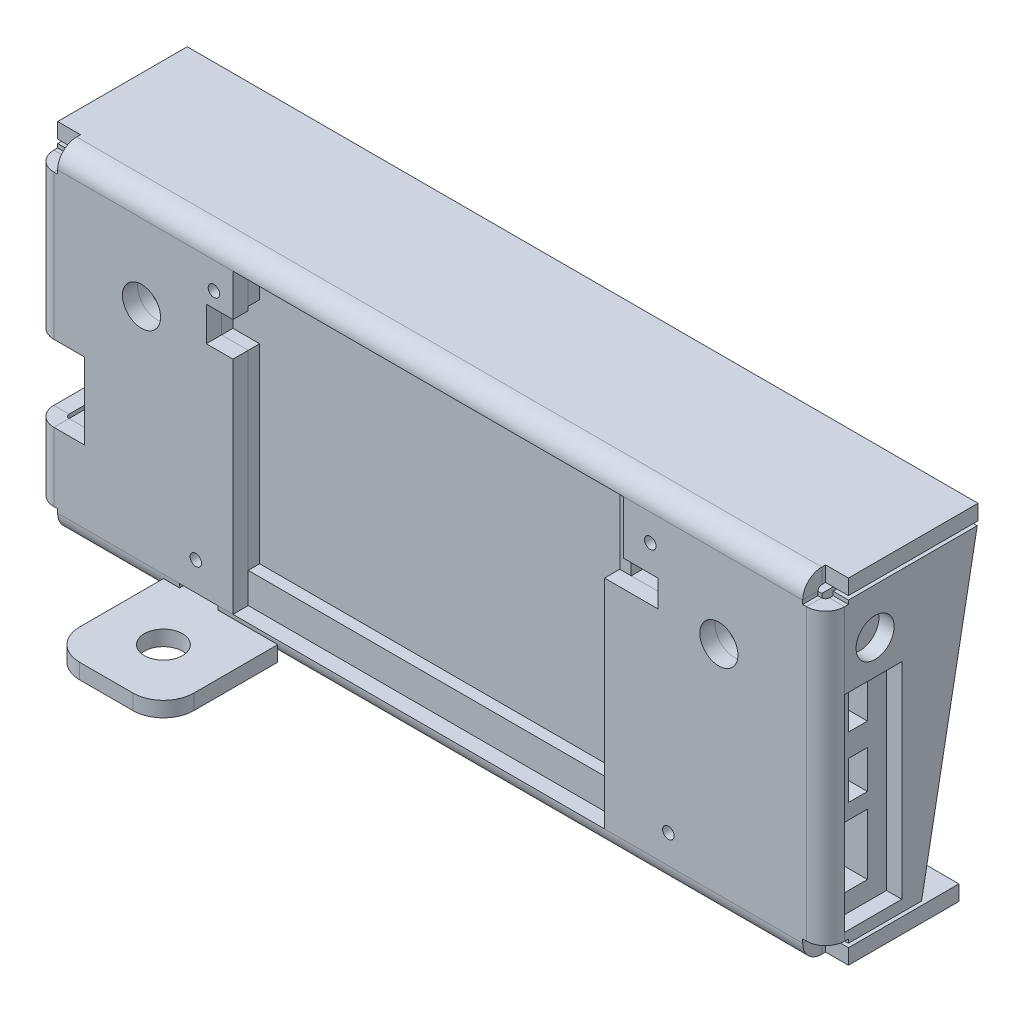
from build123d import *

# Parameters (mm, degrees)
SKETCH1_R               = 1.2
SKETCH1_R_2             = 5
SKETCH1_W               = 13
SKETCH1_H               = 11
SKETCH1_W_2             = 10
SKETCH1_H_2             = 16
BOSS_EXTRUDE2_DEPTH     = 3
SKETCH2_W               = 197.5
SKETCH2_H               = 78
BOSS_EXTRUDE3_DEPTH     = 18
SKETCH3_W               = 191.5
SKETCH3_H               = 72
CUT_EXTRUDE1_DEPTH      = 1
SKETCH4_W               = 177.5
SKETCH4_H               = 55
CUT_EXTRUDE2_DEPTH      = 1
SKETCH5_W               = 11
SKETCH5_H               = 20
CUT_EXTRUDE3_DEPTH      = 8
SKETCH6_R               = 1
SKETCH6_W               = 7
SKETCH6_H               = 16
SKETCH6_W_2             = 5
SKETCH6_H_2             = 10
CUT_EXTRUDE4_DEPTH      = 10
SKETCH7_R               = 1.5
SKETCH7_R_2             = 5
BOSS_EXTRUDE4_DEPTH     = 4
SKETCH10_R              = 5
BOSS_EXTRUDE6_DEPTH     = 4
SKETCH11_W              = 207.5
SKETCH11_H              = 40
BOSS_EXTRUDE7_DEPTH     = 4
SKETCH22_R              = 5
SKETCH22_W              = 15
SKETCH22_H              = 54
BOSS_EXTRUDE9_DEPTH     = 4
BOSS_EXTRUDE10_DEPTH    = 4
SKETCH30_W              = 10
SKETCH30_H              = 10
CUT_EXTRUDE5_DEPTH      = 5
CONVERT_SOLID4_START    = -5
CONVERT_SOLID4_DEPTH    = 207.5
CONVERT_SOLID4_2_DEPTH  = 207.5
CONVERT_SOLID4_3_DEPTH  = 6
CONVERT_SOLID4_START_2  = 196.5
CONVERT_SOLID4_4_DEPTH  = 6
CONVERT_SOLID4_START_3  = 43
CONVERT_SOLID4_5_DEPTH  = 153.5
CONVERT_SOLID4_START_4  = 1
CONVERT_SOLID4_6_DEPTH  = 32
CONVERT_SOLID4_START_5  = 33
CONVERT_SOLID4_7_DEPTH  = 10
CONVERT_SOLID4_8_DEPTH  = 76
CONVERT_SOLID4_9_DEPTH  = 76
CONVERT_SOLID4_START_6  = 39
CONVERT_SOLID4_10_DEPTH = 38
CONVERT_SOLID4_11_DEPTH = 18
SKETCH31_R              = 5
BOSS_EXTRUDE12_DEPTH    = 4


with BuildPart() as part:
    # Sketch1 → Boss-Extrude2 (new body)
    with BuildSketch(Plane.XY):
        Polygon((0, 0), (197.5, 0), (197.5, 78), (0, 78), (0, 39), (8, 39), (8, 19), (0, 19), align=None)
        with Locations((37.25, 7.5)):
            Circle(SKETCH1_R, mode=Mode.SUBTRACT)
        with Locations((161.25, 7.5)):
            Circle(SKETCH1_R, mode=Mode.SUBTRACT)
        with Locations((156.5, 71)):
            Circle(SKETCH1_R, mode=Mode.SUBTRACT)
        with Locations((42, 71)):
            Circle(SKETCH1_R, mode=Mode.SUBTRACT)
        with Locations((23, 58)):
            Circle(SKETCH1_R_2, mode=Mode.SUBTRACT)
        with Locations((174.5, 57)):
            Circle(SKETCH1_R_2, mode=Mode.SUBTRACT)
        Polygon((47, 75), (47, 68), (40, 68), (40, 58), (47, 58), (47, 8), (144.5, 8), (144.5, 75), align=None, mode=Mode.SUBTRACT)
        with Locations((154, 62.5)):
            Rectangle(SKETCH1_W, SKETCH1_H, mode=Mode.SUBTRACT)
        with Locations((169.5, 14)):
            Rectangle(SKETCH1_W_2, SKETCH1_H_2, mode=Mode.SUBTRACT)
        with Locations((29, 14)):
            Rectangle(SKETCH1_W_2, SKETCH1_H_2, mode=Mode.SUBTRACT)
    extrude(amount=BOSS_EXTRUDE2_DEPTH)

    # Sketch2 → Boss-Extrude3 (add)
    with BuildSketch(Plane(origin=(0, 0, 0), x_dir=(-1, 0, 0), z_dir=(0, 0, -1))):
        with Locations((-98.75, 39)):
            Rectangle(SKETCH2_W, SKETCH2_H)
    extrude(amount=BOSS_EXTRUDE3_DEPTH)

    # Sketch3 → Cut-Extrude1 (cut)
    with BuildSketch(Plane(origin=(0, 0, -18), x_dir=(-1, 0, 0), z_dir=(0, 0, -1))):
        with Locations((-98.75, 39)):
            Rectangle(SKETCH3_W, SKETCH3_H)
    extrude(amount=-CUT_EXTRUDE1_DEPTH, mode=Mode.SUBTRACT)

    # Sketch4 → Cut-Extrude2 (cut)
    with BuildSketch(Plane(origin=(0, 0, -17), x_dir=(-1, 0, 0), z_dir=(0, 0, -1))):
        with Locations((-98.75, 42.5)):
            Rectangle(SKETCH4_W, SKETCH4_H)
    extrude(amount=-CUT_EXTRUDE2_DEPTH, mode=Mode.SUBTRACT)

    # Sketch5 → Cut-Extrude3 (cut)
    with BuildSketch(Plane.ZY):
        with Locations((-2.5, 29)):
            Rectangle(SKETCH5_W, SKETCH5_H)
    extrude(amount=-CUT_EXTRUDE3_DEPTH, mode=Mode.SUBTRACT)

    # Sketch6 → Cut-Extrude4 (cut)
    with BuildSketch(Plane(origin=(197.5, 0, 0), x_dir=(0, 0, -1), z_dir=(1, 0, 0))):
        with Locations((6, 66)):
            Circle(SKETCH6_R)
        with Locations((5.5, 15)):
            Rectangle(SKETCH6_W, SKETCH6_H)
        with Locations((6.5, 32)):
            Rectangle(SKETCH6_W_2, SKETCH6_H_2)
        with Locations((6.5, 48)):
            Rectangle(SKETCH6_W_2, SKETCH6_H_2)
    extrude(amount=-CUT_EXTRUDE4_DEPTH, mode=Mode.SUBTRACT)


with BuildPart() as body_2:
    # Sketch7 → Boss-Extrude4 (new body)
    with BuildSketch(Plane.XY.offset(3)):
        Polygon((-1, 79), (198.5, 79), (198.5, -1), (-1, -1), (-1, 19), (8, 19), (8, 39), (-1, 39), align=None)
        with Locations((42, 71)):
            Circle(SKETCH7_R, mode=Mode.SUBTRACT)
        with Locations((37.25, 7.5)):
            Circle(SKETCH7_R, mode=Mode.SUBTRACT)
        with Locations((156.5, 71)):
            Circle(SKETCH7_R, mode=Mode.SUBTRACT)
        with Locations((161.25, 7.5)):
            Circle(SKETCH7_R, mode=Mode.SUBTRACT)
        with Locations((174.5, 57)):
            Circle(SKETCH7_R_2, mode=Mode.SUBTRACT)
        with Locations((23, 58)):
            Circle(SKETCH7_R_2, mode=Mode.SUBTRACT)
        Polygon((40, 67), (47, 67), (47, 78), (149.5, 78), (149.5, 64), (158.5, 64), (158.5, 57), (144.5, 57), (144.5, 0), (47, 0), (47, 58), (40, 58), align=None, mode=Mode.SUBTRACT)
    extrude(amount=BOSS_EXTRUDE4_DEPTH)

    # Sketch10 → Boss-Extrude6 (add)
    with BuildSketch(Plane.XZ.offset(1)):
        with BuildLine():
            Line((121.75, -28), (198.5, -28))
            Line((198.5, -28), (198.5, 7))
            Line((198.5, 7), (-1, 7))
            Line((-1, 7), (-1, -18))
            Line((-1, -18), (29, -18))
            Line((29, -18), (59, -28))
            Line((59, -28), (75.75, -28))
            ThreePointArc((75.75, -28), (81.406854249, -30.343145751), (83.75, -36))
            Line((83.75, -36), (83.75, -40))
            ThreePointArc((83.75, -40), (86.093145751, -45.656854249), (91.75, -48))
            Line((91.75, -48), (105.75, -48))
            ThreePointArc((105.75, -48), (111.406854249, -45.656854249), (113.75, -40))
            Line((113.75, -40), (113.75, -36))
            ThreePointArc((113.75, -36), (116.093145751, -30.343145751), (121.75, -28))
        make_face()
        with Locations((98.75, -33)):
            Circle(SKETCH10_R, mode=Mode.SUBTRACT)
    extrude(amount=BOSS_EXTRUDE6_DEPTH)

    # Sketch11 → Boss-Extrude7 (add)
    with BuildSketch(Plane(origin=(0, 79, 0), x_dir=(1, 0, 0), z_dir=(0, 1, 0))):
        with Locations((98.75, 13)):
            Rectangle(SKETCH11_W, SKETCH11_H)
    extrude(amount=BOSS_EXTRUDE7_DEPTH)

    # Sketch22 → Boss-Extrude9 (add)
    with BuildSketch(Plane(origin=(198.5, 0, 0), x_dir=(0, 0, -1), z_dir=(1, 0, 0))):
        Polygon((-7, -5), (28, -5), (28, -1), (18, -1), (33, 79), (-7, 79), align=None)
        with Locations((6, 66)):
            Circle(SKETCH22_R, mode=Mode.SUBTRACT)
        with Locations((5.5, 30)):
            Rectangle(SKETCH22_W, SKETCH22_H, mode=Mode.SUBTRACT)
    extrude(amount=BOSS_EXTRUDE9_DEPTH)

    # Sketch23 → Boss-Extrude10 (add)
    with BuildSketch(Plane.ZY.offset(1)):
        Polygon((7, 19), (-8, 19), (-8, 39), (7, 39), (7, 79), (-33, 79), (-18, -1), (-18, -5), (7, -5), align=None)
    extrude(amount=BOSS_EXTRUDE10_DEPTH)

    # Sketch30 → Cut-Extrude5 (cut)
    with BuildSketch(Plane.XZ.offset(5)):
        with Locations((38, 2)):
            Rectangle(SKETCH30_W, SKETCH30_H)
    extrude(amount=-CUT_EXTRUDE5_DEPTH, mode=Mode.SUBTRACT)

    # Convert-Solid4: read off the stored shape, not the designer's step
    # Convert-Solid4 outline → Convert-Solid4 (cut)
    with BuildSketch(Plane.YZ.offset(CONVERT_SOLID4_START)):
        with BuildLine():
            ThreePointArc((78, 7), (81.535533906, 5.535533906), (83, 2))
            Line((83, 2), (83, 7))
            Line((83, 7), (78, 7))
        make_face()
    extrude(amount=CONVERT_SOLID4_DEPTH, mode=Mode.SUBTRACT)

    # Convert-Solid4 2 outline → Convert-Solid4 2 (cut)
    with BuildSketch(Plane.YZ.offset(CONVERT_SOLID4_START)):
        with BuildLine():
            Line((77, 1), (78, 1))
            Line((78, 1), (78.00501662, -32.813440616))
            Line((78.00501662, -32.813440616), (79, -33))
            Line((79, -33), (79, 2))
            ThreePointArc((79, 2), (78.707106781, 2.707106781), (78, 3))
            Line((78, 3), (77, 3))
            Line((77, 3), (77, 1))
        make_face()
        with BuildLine():
            Line((-1, -18), (-0.00501662, -18.186559384))
            Line((-0.00501662, -18.186559384), (0, 1))
            Line((0, 1), (1, 1))
            Line((1, 1), (1, 3))
            Line((1, 3), (0, 3))
            ThreePointArc((0, 3), (-0.707106781, 2.707106781), (-1, 2))
            Line((-1, 2), (-1, -18))
        make_face()
        with BuildLine():
            Line((-5, 7), (-5, 2))
            ThreePointArc((-5, 2), (-3.535533906, 5.535533906), (0, 7))
            Line((0, 7), (-5, 7))
        make_face()
    extrude(amount=CONVERT_SOLID4_2_DEPTH, mode=Mode.SUBTRACT)

    # Convert-Solid4 3 outline → Convert-Solid4 3 (cut)
    with BuildSketch(Plane.YZ.offset(CONVERT_SOLID4_START)):
        with BuildLine():
            Line((77, 7), (77, 3))
            Line((77, 3), (78, 3))
            ThreePointArc((78, 3), (78.707106781, 2.707106781), (79, 2))
            Line((79, 2), (79, 1))
            Line((79, 1), (83, 1))
            Line((83, 1), (83, 2))
            ThreePointArc((83, 2), (81.535533906, 5.535533906), (78, 7))
            Line((78, 7), (77, 7))
        make_face()
        with BuildLine():
            Line((-5, 1), (-1, 1))
            Line((-1, 1), (-1, 2))
            ThreePointArc((-1, 2), (-0.707106781, 2.707106781), (0, 3))
            Line((0, 3), (1, 3))
            Line((1, 3), (1, 7))
            Line((1, 7), (0, 7))
            ThreePointArc((0, 7), (-3.535533906, 5.535533906), (-5, 2))
            Line((-5, 2), (-5, 1))
        make_face()
    extrude(amount=CONVERT_SOLID4_3_DEPTH, mode=Mode.SUBTRACT)

    # Convert-Solid4 4 outline → Convert-Solid4 4 (cut)
    with BuildSketch(Plane.YZ.offset(CONVERT_SOLID4_START_2)):
        with BuildLine():
            Line((77, 7), (77, 3))
            Line((77, 3), (78, 3))
            ThreePointArc((78, 3), (78.707106781, 2.707106781), (79, 2))
            Line((79, 2), (79, 1))
            Line((79, 1), (83, 1))
            Line((83, 1), (83, 2))
            ThreePointArc((83, 2), (81.535533906, 5.535533906), (78, 7))
            Line((78, 7), (77, 7))
        make_face()
        with BuildLine():
            Line((-5, 1), (-1, 1))
            Line((-1, 1), (-1, 2))
            ThreePointArc((-1, 2), (-0.707106781, 2.707106781), (0, 3))
            Line((0, 3), (1, 3))
            Line((1, 3), (1, 7))
            Line((1, 7), (0, 7))
            ThreePointArc((0, 7), (-3.535533906, 5.535533906), (-5, 2))
            Line((-5, 2), (-5, 1))
        make_face()
    extrude(amount=CONVERT_SOLID4_4_DEPTH, mode=Mode.SUBTRACT)

    # Convert-Solid4 5 outline → Convert-Solid4 5 (add)
    with BuildSketch(Plane.YZ.offset(CONVERT_SOLID4_START_3)):
        with BuildLine():
            Line((79, 3), (78, 3))
            ThreePointArc((78, 3), (78.707106781, 2.707106781), (79, 2))
            Line((79, 2), (79, 3))
        make_face()
        with BuildLine():
            Line((-1, 3), (-1, 2))
            ThreePointArc((-1, 2), (-0.707106781, 2.707106781), (0, 3))
            Line((0, 3), (-1, 3))
        make_face()
    extrude(amount=CONVERT_SOLID4_5_DEPTH)

    # Convert-Solid4 6 outline → Convert-Solid4 6 (add)
    with BuildSketch(Plane.YZ.offset(CONVERT_SOLID4_START_4)):
        with BuildLine():
            Line((79, 3), (78, 3))
            ThreePointArc((78, 3), (78.707106781, 2.707106781), (79, 2))
            Line((79, 2), (79, 3))
        make_face()
        with BuildLine():
            Line((-1, 3), (-1, 2))
            ThreePointArc((-1, 2), (-0.707106781, 2.707106781), (0, 3))
            Line((0, 3), (-1, 3))
        make_face()
    extrude(amount=CONVERT_SOLID4_6_DEPTH)

    # Convert-Solid4 7 outline → Convert-Solid4 7 (add)
    with BuildSketch(Plane.YZ.offset(CONVERT_SOLID4_START_5)):
        with BuildLine():
            Line((79, 3), (78, 3))
            ThreePointArc((78, 3), (78.707106781, 2.707106781), (79, 2))
            Line((79, 2), (79, 3))
        make_face()
    extrude(amount=CONVERT_SOLID4_7_DEPTH)

    # Convert-Solid4 8 outline → Convert-Solid4 8 (cut)
    with BuildSketch(Plane(origin=(0, 0, 0), x_dir=(1, 0, 0), z_dir=(0, 1, 0)).offset(CONVERT_SOLID4_START_4)):
        with BuildLine():
            ThreePointArc((0, -7), (-3.535533906, -5.535533906), (-5, -2))
            Line((-5, -2), (-5, -7))
            Line((-5, -7), (0, -7))
        make_face()
        with BuildLine():
            Line((202.5, -7), (202.5, -2))
            ThreePointArc((202.5, -2), (201.035533906, -5.535533906), (197.5, -7))
            Line((197.5, -7), (202.5, -7))
        make_face()
    extrude(amount=CONVERT_SOLID4_8_DEPTH, mode=Mode.SUBTRACT)

    # Convert-Solid4 9 outline → Convert-Solid4 9 (add)
    with BuildSketch(Plane(origin=(0, 0, 0), x_dir=(1, 0, 0), z_dir=(0, 1, 0)).offset(CONVERT_SOLID4_START_4)):
        with BuildLine():
            Line((198.5, -3), (198.5, -2))
            ThreePointArc((198.5, -2), (198.207106781, -2.707106781), (197.5, -3))
            Line((197.5, -3), (198.5, -3))
        make_face()
    extrude(amount=CONVERT_SOLID4_9_DEPTH)

    # Convert-Solid4 10 outline → Convert-Solid4 10 (add)
    with BuildSketch(Plane(origin=(0, 0, 0), x_dir=(1, 0, 0), z_dir=(0, 1, 0)).offset(CONVERT_SOLID4_START_6)):
        with BuildLine():
            ThreePointArc((0, -3), (-0.707106781, -2.707106781), (-1, -2))
            Line((-1, -2), (-1, -3))
            Line((-1, -3), (0, -3))
        make_face()
    extrude(amount=CONVERT_SOLID4_10_DEPTH)

    # Convert-Solid4 11 outline → Convert-Solid4 11 (add)
    with BuildSketch(Plane(origin=(0, 0, 0), x_dir=(1, 0, 0), z_dir=(0, 1, 0)).offset(CONVERT_SOLID4_START_4)):
        with BuildLine():
            ThreePointArc((0, -3), (-0.707106781, -2.707106781), (-1, -2))
            Line((-1, -2), (-1, -3))
            Line((-1, -3), (0, -3))
        make_face()
    extrude(amount=CONVERT_SOLID4_11_DEPTH)


with BuildPart() as body_3:
    # Sketch31 → Boss-Extrude12 (new body)
    with BuildSketch(Plane(origin=(0, -5, 0), x_dir=(1, 0, 0), z_dir=(0, 1, 0))):
        with BuildLine():
            Line((33, -7), (28.75, -7))
            Line((28.75, -7), (28.75, -29))
            ThreePointArc((28.75, -29), (31.093145751, -34.656854249), (36.75, -37))
            Line((36.75, -37), (50.75, -37))
            ThreePointArc((50.75, -37), (56.406854249, -34.656854249), (58.75, -29))
            Line((58.75, -29), (58.75, -7))
            Line((58.75, -7), (43, -7))
            Line((43, -7), (43, 3))
            Line((43, 3), (33, 3))
            Line((33, 3), (33, -7))
        make_face()
        with Locations(Location((43.75, -22, 0), (0, 0, 180))):
            Circle(SKETCH31_R, mode=Mode.SUBTRACT)
    extrude(amount=BOSS_EXTRUDE12_DEPTH)


solid = Compound([part.part, body_2.part, body_3.part])
